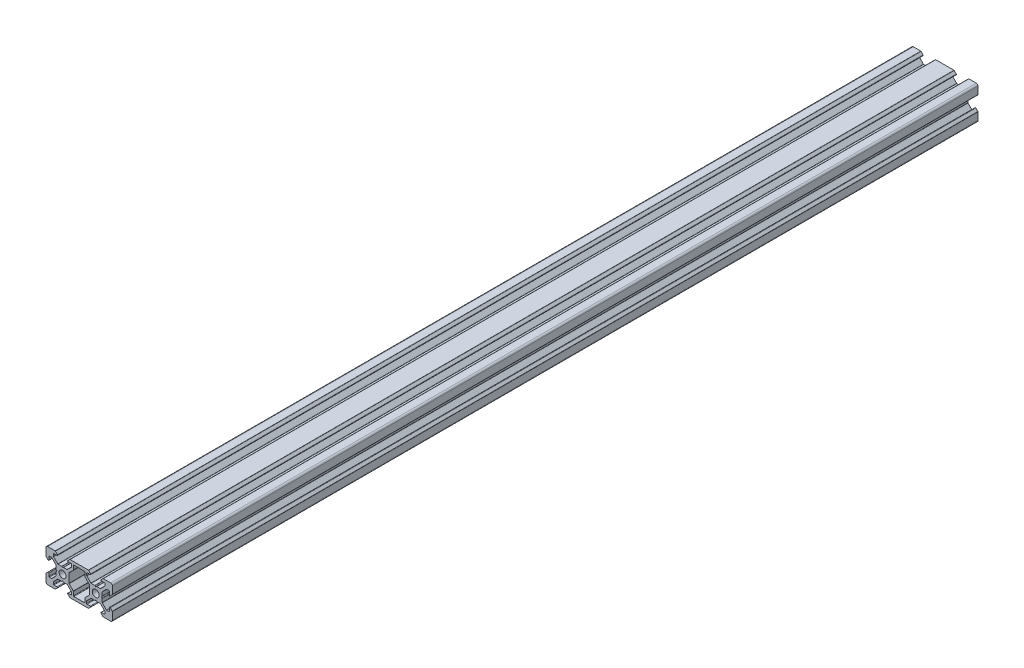
from build123d import *

# Parameters (mm, degrees)
SKETCH_1_R      = 2.1
EXTRUDE_1_DEPTH = 522
FILLET_1_R      = 1
FILLET_2_R      = 0.3


with BuildPart() as part:
    # Эскиз1 → Бобышка-Вытянуть1 (new body)
    with BuildSketch(Plane.XY):
        Polygon((-10, -10), (-10, -4.4), (-8.2, -2.6), (-8.2, -5.499339828), (-6.56, -5.499339828), (-3.900660172, -2.84), (-3.900660172, -0.5), (-3.400660172, 0), (-3.900660172, 0.5), (-3.900660172, 2.84), (-6.56, 5.499339828), (-8.2, 5.499339828), (-8.2, 2.6), (-10, 4.4), (-10, 10), (-4.4, 10), (-2.6, 8.2), (-5.499339828, 8.2), (-5.499339828, 6.56), (-2.84, 3.900660172), (-0.5, 3.900660172), (0, 3.400660172), (0.5, 3.900660172), (2.84, 3.900660172), (5.499339828, 6.56), (5.499339828, 8.2), (2.6, 8.2), (4.4, 10), (15.6, 10), (17.4, 8.2), (14.500660172, 8.2), (14.500660172, 6.56), (17.16, 3.900660172), (19.5, 3.900660172), (20, 3.400660172), (20.5, 3.900660172), (22.84, 3.900660172), (25.499339828, 6.56), (25.499339828, 8.2), (22.6, 8.2), (24.4, 10), (30, 10), (30, 4.4), (28.2, 2.6), (28.2, 5.499339828), (26.56, 5.499339828), (23.900660172, 2.84), (23.900660172, 0.5), (23.400660172, 0), (23.900660172, -0.5), (23.900660172, -2.84), (26.56, -5.499339828), (28.2, -5.499339828), (28.2, -2.6), (30, -4.4), (30, -10), (24.4, -10), (22.6, -8.2), (25.499339828, -8.2), (25.499339828, -6.56), (22.84, -3.900660172), (20.5, -3.900660172), (20, -3.400660172), (19.5, -3.900660172), (17.16, -3.900660172), (14.500660172, -6.56), (14.500660172, -8.2), (17.4, -8.2), (15.6, -10), (4.4, -10), (2.6, -8.2), (5.499339828, -8.2), (5.499339828, -6.56), (2.84, -3.900660172), (0.5, -3.900660172), (0, -3.400660172), (-0.5, -3.900660172), (-2.84, -3.900660172), (-5.499339828, -6.56), (-5.499339828, -8.2), (-2.6, -8.2), (-4.4, -10), align=None)
        Circle(SKETCH_1_R, mode=Mode.SUBTRACT)
        with Locations((20, 0)):
            Circle(SKETCH_1_R, mode=Mode.SUBTRACT)
        Polygon((3.900660172, -0.5), (3.900660172, 0.5), (3.900660172, 2.84), (6.56, 5.499339828), (6.56, 8.2), (13.44, 8.2), (13.44, 5.499339828), (16.099339828, 2.84), (16.099339828, 0.5), (16.099339828, -0.5), (16.099339828, -2.84), (13.44, -5.499339828), (13.44, -8.2), (6.56, -8.2), (6.56, -5.499339828), (3.900660172, -2.84), align=None, mode=Mode.SUBTRACT)
    extrude(amount=EXTRUDE_1_DEPTH)

    # Скругление1
    fillet_1_edges = [part.edges().sort_by_distance(p)[0] for p in [
        (-10, 10, 261),
        (-10, -10, 261),
        (30, 10, 261),
        (30, -10, 261),
    ]]
    fillet(fillet_1_edges, radius=FILLET_1_R)

    # Скругление2
    fillet_2_edges = [part.edges().sort_by_distance(p)[0] for p in [
        (-4.4, 10, 261),
        (-2.6, 8.2, 261),
        (-5.499339828, 8.2, 261),
        (-5.499339828, 6.56, 261),
        (-2.84, 3.900660172, 261),
        (-0.5, 3.900660172, 261),
        (0.5, 3.900660172, 261),
        (2.84, 3.900660172, 261),
        (5.499339828, 6.56, 261),
        (4.4, 10, 261),
        (5.499339828, 8.2, 261),
        (2.6, 8.2, 261),
        (3.900660172, 2.84, 261),
        (3.900660172, -2.84, 261),
        (4.4, -10, 261),
        (2.6, -8.2, 261),
        (5.499339828, -8.2, 261),
        (5.499339828, -6.56, 261),
        (2.84, -3.900660172, 261),
        (0.5, -3.900660172, 261),
        (-0.5, -3.900660172, 261),
        (-2.84, -3.900660172, 261),
        (-5.499339828, -6.56, 261),
        (-5.499339828, -8.2, 261),
        (-2.6, -8.2, 261),
        (-10, -4.4, 261),
        (-8.2, -2.6, 261),
        (-8.2, -5.499339828, 261),
        (-6.56, -5.499339828, 261),
        (-3.900660172, -2.84, 261),
        (-3.900660172, -0.5, 261),
        (-3.900660172, 0.5, 261),
        (-3.900660172, 2.84, 261),
        (-6.56, 5.499339828, 261),
        (-8.2, 5.499339828, 261),
        (-8.2, 2.6, 261),
        (-10, 4.4, 261),
        (6.56, -5.499339828, 261),
        (6.56, 5.499339828, 261),
        (6.56, 8.2, 261),
        (13.44, 8.2, 261),
        (13.44, 5.499339828, 261),
        (16.099339828, 2.84, 261),
        (16.099339828, -2.84, 261),
        (13.44, -5.499339828, 261),
        (13.44, -8.2, 261),
        (6.56, -8.2, 261),
        (15.6, 10, 261),
        (17.4, 8.2, 261),
        (14.500660172, 8.2, 261),
        (14.500660172, 6.56, 261),
        (17.16, 3.900660172, 261),
        (19.5, 3.900660172, 261),
        (20.5, 3.900660172, 261),
        (22.84, 3.900660172, 261),
        (25.499339828, 6.56, 261),
        (25.499339828, 8.2, 261),
        (22.6, 8.2, 261),
        (24.4, 10, 261),
        (30, 4.4, 261),
        (28.2, 2.6, 261),
        (28.2, 5.499339828, 261),
        (26.56, 5.499339828, 261),
        (23.900660172, 2.84, 261),
        (23.900660172, 0.5, 261),
        (23.900660172, -0.5, 261),
        (23.900660172, -2.84, 261),
        (26.56, -5.499339828, 261),
        (28.2, -5.499339828, 261),
        (28.2, -2.6, 261),
        (30, -4.4, 261),
        (24.4, -10, 261),
        (22.6, -8.2, 261),
        (25.499339828, -8.2, 261),
        (25.499339828, -6.56, 261),
        (22.84, -3.900660172, 261),
        (20.5, -3.900660172, 261),
        (19.5, -3.900660172, 261),
        (17.16, -3.900660172, 261),
        (14.500660172, -6.56, 261),
        (14.500660172, -8.2, 261),
        (17.4, -8.2, 261),
        (15.6, -10, 261),
    ]]
    fillet(fillet_2_edges, radius=FILLET_2_R)


solid = part.part
